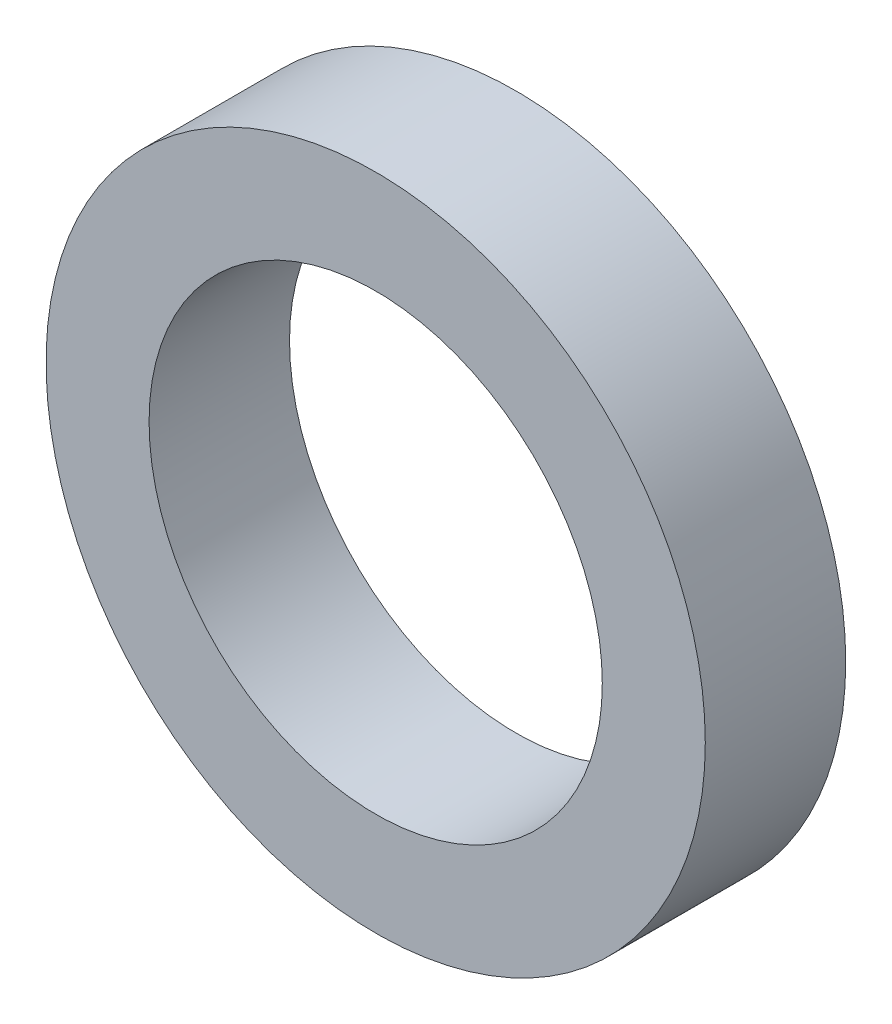
from build123d import *

# Parameters (mm, degrees)
SKETCH1_R           = 9.2
SKETCH1_R_2         = 6.325
BOSS_EXTRUDE1_DEPTH = 3.92


with BuildPart() as part:
    # Sketch1 → Boss-Extrude1 (new body)
    with BuildSketch(Plane.XY):
        Circle(SKETCH1_R)
        Circle(SKETCH1_R_2, mode=Mode.SUBTRACT)
    extrude(amount=BOSS_EXTRUDE1_DEPTH)


solid = part.part
